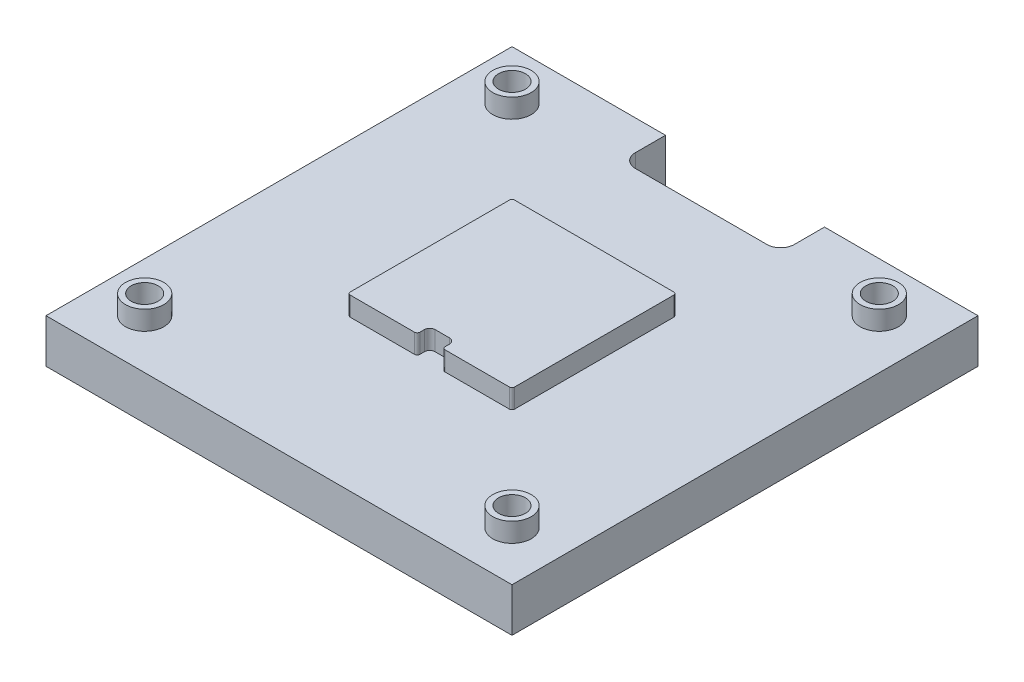
from build123d import *

# Parameters (mm, degrees)
SKETCH1_W           = 85
SKETCH1_H           = 85
SKETCH1_R           = 2.4575
BOSS_EXTRUDE1_DEPTH = 8
SKETCH2_R           = 3.969
CUT_EXTRUDE1_DEPTH  = 4.166
SKETCH3_R           = 3.5
SKETCH3_R_2         = 2.4575
BOSS_EXTRUDE2_DEPTH = 3.5
BOSS_EXTRUDE3_DEPTH = 3.5
SKETCH5_W           = 29
SKETCH5_H           = 8
CUT_EXTRUDE2_DEPTH  = 10
FILLET1_R           = 2.5


with BuildPart() as part:
    # Sketch1 → Boss-Extrude1 (new body)
    with BuildSketch(Plane(origin=(0, 0, 0), x_dir=(1, 0, 0), z_dir=(0, 1, 0))):
        Rectangle(SKETCH1_W, SKETCH1_H)
        with Locations((-33.5, 33.5)):
            Circle(SKETCH1_R, mode=Mode.SUBTRACT)
        with Locations((-33.5, -33.5)):
            Circle(SKETCH1_R, mode=Mode.SUBTRACT)
        with Locations((33.5, -33.5)):
            Circle(SKETCH1_R, mode=Mode.SUBTRACT)
        with Locations((33.5, 33.5)):
            Circle(SKETCH1_R, mode=Mode.SUBTRACT)
    extrude(amount=BOSS_EXTRUDE1_DEPTH)

    # Sketch2 → Cut-Extrude1 (cut)
    with BuildSketch(Plane.XZ):
        with Locations((-33.5, 33.5)):
            Circle(SKETCH2_R)
        with Locations((33.5, 33.5)):
            Circle(SKETCH2_R)
        with Locations((33.5, -33.5)):
            Circle(SKETCH2_R)
        with Locations((-33.5, -33.5)):
            Circle(SKETCH2_R)
    extrude(amount=-CUT_EXTRUDE1_DEPTH, mode=Mode.SUBTRACT)

    # Sketch3 → Boss-Extrude2 (add)
    # profile 1 of 4: a face of its own
    with BuildSketch(Plane(origin=(0, 8, 0), x_dir=(1, 0, 0), z_dir=(0, 1, 0))):
        with Locations((33.5, -33.5)):
            Circle(SKETCH3_R)
        with Locations((33.5, -33.5)):
            Circle(SKETCH3_R_2, mode=Mode.SUBTRACT)
    # profile 2 of 4: a face of its own
    with BuildSketch(Plane(origin=(0, 8, 0), x_dir=(1, 0, 0), z_dir=(0, 1, 0))):
        with Locations((-33.5, -33.5)):
            Circle(SKETCH3_R)
        with Locations((-33.5, -33.5)):
            Circle(SKETCH3_R_2, mode=Mode.SUBTRACT)
    # profile 3 of 4: a face of its own
    with BuildSketch(Plane(origin=(0, 8, 0), x_dir=(1, 0, 0), z_dir=(0, 1, 0))):
        with Locations((-33.5, 33.5)):
            Circle(SKETCH3_R)
        with Locations((-33.5, 33.5)):
            Circle(SKETCH3_R_2, mode=Mode.SUBTRACT)
    # profile 4 of 4: a face of its own
    with BuildSketch(Plane(origin=(0, 8, 0), x_dir=(1, 0, 0), z_dir=(0, 1, 0))):
        with Locations((33.5, 33.5)):
            Circle(SKETCH3_R)
        with Locations((33.5, 33.5)):
            Circle(SKETCH3_R_2, mode=Mode.SUBTRACT)
    extrude(amount=BOSS_EXTRUDE2_DEPTH)

    # Sketch4 → Boss-Extrude3 (add)
    with BuildSketch(Plane(origin=(0, 8, 0), x_dir=(1, 0, 0), z_dir=(0, 1, 0))):
        with BuildLine():
            Line((2.2929, -14.5), (2.2929, -13.7071))
            ThreePointArc((2.2929, -13.7071), (2.000006781, -12.999993219), (1.2929, -12.7071))
            Line((1.2929, -12.7071), (-1.2929, -12.7071))
            ThreePointArc((-1.2929, -12.7071), (-2.000006781, -12.999993219), (-2.2929, -13.7071))
            Line((-2.2929, -13.7071), (-2.2929, -14.5))
            ThreePointArc((-2.2929, -14.5), (-2.439346609, -14.853553391), (-2.7929, -15))
            Line((-2.7929, -15), (-14.5, -15))
            ThreePointArc((-14.5, -15), (-14.853553391, -14.853553391), (-15, -14.5))
            Line((-15, -14.5), (-15, 14.5))
            ThreePointArc((-15, 14.5), (-14.853553391, 14.853553391), (-14.5, 15))
            Line((-14.5, 15), (14.5, 15))
            ThreePointArc((14.5, 15), (14.853553391, 14.853553391), (15, 14.5))
            Line((15, 14.5), (15, -14.5))
            ThreePointArc((15, -14.5), (14.853553391, -14.853553391), (14.5, -15))
            Line((14.5, -15), (2.7929, -15))
            ThreePointArc((2.7929, -15), (2.439346609, -14.853553391), (2.2929, -14.5))
        make_face()
    extrude(amount=BOSS_EXTRUDE3_DEPTH)

    # Sketch5 → Cut-Extrude2 (cut)
    with BuildSketch(Plane(origin=(0, 8, 0), x_dir=(1, 0, 0), z_dir=(0, 1, 0))):
        with Locations((0, 38.5)):
            Rectangle(SKETCH5_W, SKETCH5_H)
    extrude(amount=-CUT_EXTRUDE2_DEPTH, mode=Mode.SUBTRACT)

    # Fillet1
    fillet1_edges = [part.edges().sort_by_distance(p)[0] for p in [
        (-14.5, 4, -34.5),
        (14.5, 4, -34.5),
    ]]
    fillet(fillet1_edges, radius=FILLET1_R)


solid = part.part
